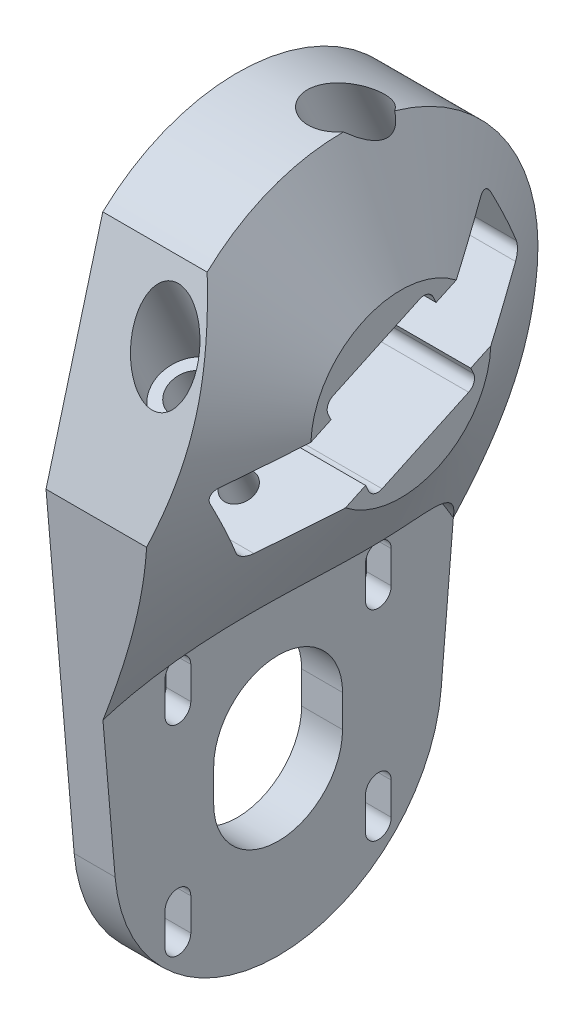
from build123d import *

# Parameters (mm, degrees)
BOSS_EXTRUDE1_DEPTH = 6.35
CUT_EXTRUDE18_DEPTH = 10
SKETCH20_R          = 57.15
BOSS_EXTRUDE5_DEPTH = 19.05
CUT_EXTRUDE14_DEPTH = 106.568863781
SKETCH22_R          = 3.175
CUT_EXTRUDE15_DEPTH = 112.672649781
SKETCH24_R          = 5
CUT_EXTRUDE16_DEPTH = 117.574618566
SKETCH25_R          = 2.38125
CUT_EXTRUDE17_DEPTH = 10
CHAMFER2_SIZE       = 2.5
FILLET1_R           = 1.5875
SKETCH28_R          = 31
CUT_EXTRUDE19_DEPTH = 105.22344993
CUT_EXTRUDE20_DEPTH = 100.584343315
CUT_EXTRUDE21_DEPTH = 94.849309593


with BuildPart() as part:
    # Sketch1 → Boss-Extrude1 (new body)
    with BuildSketch(Plane(origin=(0, 0, 0), x_dir=(0, 0, -1), z_dir=(1, 0, 0))):
        with BuildLine():
            ThreePointArc((30.369265969, -2.595782062), (0, 30.48), (-30.369265969, -2.595782062))
            Line((-30.369265969, -2.595782062), (-25.307721641, -61.813151718))
            ThreePointArc((-25.307721641, -61.813151718), (0, -85.05), (25.307721641, -61.813151718))
            Line((25.307721641, -61.813151718), (30.369265969, -2.595782062))
        make_face()
        Polygon((-11.960334439, 4.353205728), (4.353205728, 11.960334439), (11.960334439, -4.353205728), (-4.353205728, -11.960334439), align=None, mode=Mode.SUBTRACT)
    extrude(amount=BOSS_EXTRUDE1_DEPTH)

    # Sketch19 → Cut-Extrude18 (cut)
    with BuildSketch(Plane(origin=(6.35, 0, 0), x_dir=(0, 0, -1), z_dir=(1, 0, 0))):
        with BuildLine():
            Line((13.556349186, -39.093650814), (13.556349186, -44.093650814))
            ThreePointArc((13.556349186, -44.093650814), (15.556349186, -46.093650814), (17.556349186, -44.093650814))
            Line((17.556349186, -44.093650814), (17.556349186, -39.093650806))
            ThreePointArc((17.556349186, -39.093650806), (15.556349182, -37.093650814), (13.556349186, -39.093650814))
        make_face()
        with BuildLine():
            Line((-10, -54.65), (-10, -59.65))
            ThreePointArc((-10, -59.65), (0, -69.65), (10, -59.65))
            Line((10, -59.65), (10, -54.65))
            ThreePointArc((10, -54.65), (0, -44.65), (-10, -54.65))
        make_face()
        with BuildLine():
            Line((17.556349186, -75.206349194), (17.556349186, -70.206349186))
            ThreePointArc((17.556349186, -70.206349186), (15.556349186, -68.206349186), (13.556349186, -70.206349186))
            Line((13.556349186, -70.206349186), (13.556349186, -75.206349186))
            ThreePointArc((13.556349186, -75.206349186), (15.556349182, -77.206349186), (17.556349186, -75.206349194))
        make_face()
        with BuildLine():
            Line((-17.556349186, -39.093650806), (-17.556349186, -44.093650814))
            ThreePointArc((-17.556349186, -44.093650814), (-15.556349186, -46.093650814), (-13.556349186, -44.093650814))
            Line((-13.556349186, -44.093650814), (-13.556349186, -39.093650814))
            ThreePointArc((-13.556349186, -39.093650814), (-15.556349182, -37.093650814), (-17.556349186, -39.093650806))
        make_face()
        with BuildLine():
            Line((-13.556349186, -75.206349186), (-13.556349186, -70.206349186))
            ThreePointArc((-13.556349186, -70.206349186), (-15.556349186, -68.206349186), (-17.556349186, -70.206349186))
            Line((-17.556349186, -70.206349186), (-17.556349186, -75.206349194))
            ThreePointArc((-17.556349186, -75.206349194), (-15.556349182, -77.206349186), (-13.556349186, -75.206349186))
        make_face()
    extrude(amount=-CUT_EXTRUDE18_DEPTH, mode=Mode.SUBTRACT)

    # Sketch20 → Boss-Extrude5 (add)
    with BuildSketch(Plane(origin=(6.35, 0, 0), x_dir=(0, 0, -1), z_dir=(1, 0, 0))):
        Circle(SKETCH20_R)
    extrude(amount=BOSS_EXTRUDE5_DEPTH)

    # Sketch21 → Cut-Extrude14 (cut, through all)
    with BuildSketch(Plane.ZY):
        Polygon((-19.067760927, 15.897892729), (-24.435012851, 4.387783834), (-10.840396045, -1.951490092), (-11.960334439, -4.353205728), (4.353205728, -11.960334439), (5.473144121, -9.558618803), (19.067760927, -15.897892729), (24.435012851, -4.387783834), (10.840396045, 1.951490092), (11.960334439, 4.353205728), (-4.353205728, 11.960334439), (-5.473144121, 9.558618803), align=None)
    extrude(amount=-CUT_EXTRUDE14_DEPTH, mode=Mode.SUBTRACT)

    # Sketch22 → Cut-Extrude15 (cut, through all)
    with BuildSketch(Plane(origin=(0, 5.755054448, 2.683625962), x_dir=(-1, 0, 0), z_dir=(0, -0.9063077870366495, -0.4226182617407005))):
        with Locations((-12.5, -16.5)):
            Circle(SKETCH22_R)
    cut_extrude15 = extrude(amount=-CUT_EXTRUDE15_DEPTH, mode=Mode.SUBTRACT)

    # Sketch24 → Cut-Extrude16 (cut, through all)
    with BuildSketch(Plane(origin=(0, 10.359098006, 4.830526732), x_dir=(-1, 0, 0), z_dir=(0, -0.9063077870366495, -0.4226182617407005))):
        with Locations((-12.5, -16.5)):
            Circle(SKETCH24_R)
    cut_extrude16 = extrude(amount=-CUT_EXTRUDE16_DEPTH, mode=Mode.SUBTRACT)

    # Sketch25 → Cut-Extrude17 (cut)
    with BuildSketch(Plane(origin=(0, -5.755054448, -2.683625962), x_dir=(1, 0, 0), z_dir=(0, 0.9063077870366495, 0.4226182617407006))):
        with Locations((12.5, -16.5)):
            Circle(SKETCH25_R)
    cut_extrude17 = extrude(amount=-CUT_EXTRUDE17_DEPTH, mode=Mode.SUBTRACT)

    # Mirror1: Cut-Extrude15, Cut-Extrude16, Cut-Extrude17 across plane
    add(cut_extrude15.mirror(Plane(origin=(0, 0, 0), x_dir=(1, 0, 0), z_dir=(0, 0.42261826174070105, -0.9063077870366493))), mode=Mode.SUBTRACT)
    add(cut_extrude16.mirror(Plane(origin=(0, 0, 0), x_dir=(1, 0, 0), z_dir=(0, 0.42261826174070105, -0.9063077870366493))), mode=Mode.SUBTRACT)
    add(cut_extrude17.mirror(Plane(origin=(0, 0, 0), x_dir=(1, 0, 0), z_dir=(0, 0.42261826174070105, -0.9063077870366493))), mode=Mode.SUBTRACT)


with BuildPart() as body_2:
    # Mirror2: mirrored copy
    add(part.part.mirror(Plane(origin=(0, 0, 0), x_dir=(0, 0, 1), z_dir=(1, 0, 0))))


with BuildPart() as part_1:
    add(part.part)

    # Chamfer2
    chamfer2_edges = [part_1.edges().sort_by_distance(p)[0] for p in [
        (0, -46.093650814, 15.556349186),
        (0, -41.593650814, 13.556349186),
        (0, -37.093650814, 15.556349182),
        (0, -41.59365081, 17.556349186),
        (0, -46.093650814, -15.556349186),
        (0, -41.59365081, -17.556349186),
        (0, -41.593650814, -13.556349186),
        (0, -37.093650814, -15.556349182),
    ]]
    chamfer(chamfer2_edges, length=CHAMFER2_SIZE)

    # Fillet1
    fillet1_edges = [part_1.edges().sort_by_distance(p)[0] for p in [
        (12.7, -4.353205728, -11.960334439),
        (12.7, 4.387783834, -24.435012851),
        (12.7, 11.960334439, -4.353205728),
        (12.7, 15.897892729, -19.067760927),
        (12.7, -4.387783834, 24.435012851),
        (12.7, 4.353205728, 11.960334439),
        (12.7, -11.960334439, 4.353205728),
        (12.7, -15.897892729, 19.067760927),
    ]]
    fillet(fillet1_edges, radius=FILLET1_R)

    # Sketch28 → Cut-Extrude19 (cut, through all)
    with BuildSketch(Plane(origin=(6.35, 0, 0), x_dir=(0, 0, -1), z_dir=(1, 0, 0))):
        with Locations((0, -54.65)):
            Circle(SKETCH28_R)
    extrude(amount=CUT_EXTRUDE19_DEPTH, mode=Mode.SUBTRACT)

    # Sketch31 → Cut-Revolve1 (revolve, cut)
    with BuildSketch(Plane(origin=(0, 0, 0), x_dir=(1, 0, 0), z_dir=(0, 1, 0))):
        Polygon((25.4, -59.952108656), (25.4, -13.97), (6.35, -48.172984338), (6.35, -59.952108656), align=None)
    revolve(axis=Axis((25.4, 0, 0), (-1, 0, 0)), mode=Mode.SUBTRACT)

    # Sketch32 → Cut-Extrude20 (cut, through all)
    with BuildSketch(Plane.ZY.offset(-6.35)):
        with BuildLine():
            ThreePointArc((-30.369265969, -2.595782062), (0, 30.48), (30.369265969, -2.595782062))
            Line((30.369265969, -2.595782062), (27.192308406, -39.764491491))
            ThreePointArc((27.192308406, -39.764491491), (42.606167787, -22.480010821), (48.172984338, 0))
            ThreePointArc((48.172984338, 0), (-22.480010821, 42.606167787), (-27.192308406, -39.764491491))
            Line((-27.192308406, -39.764491491), (-30.369265969, -2.595782062))
        make_face()
    extrude(amount=-CUT_EXTRUDE20_DEPTH, mode=Mode.SUBTRACT)

    # Sketch33 → Cut-Extrude21 (cut, through all)
    with BuildSketch(Plane.ZY):
        with BuildLine():
            Line((29.679571242, -10.664842593), (30.369265969, -2.595782062))
            ThreePointArc((30.369265969, -2.595782062), (28.464776298, 10.898940787), (20.869520673, 22.214713747))
            Line((20.869520673, 22.214713747), (29.679571242, -10.664842593))
        make_face()
    extrude(amount=-CUT_EXTRUDE21_DEPTH, mode=Mode.SUBTRACT)


solid = part_1.part
